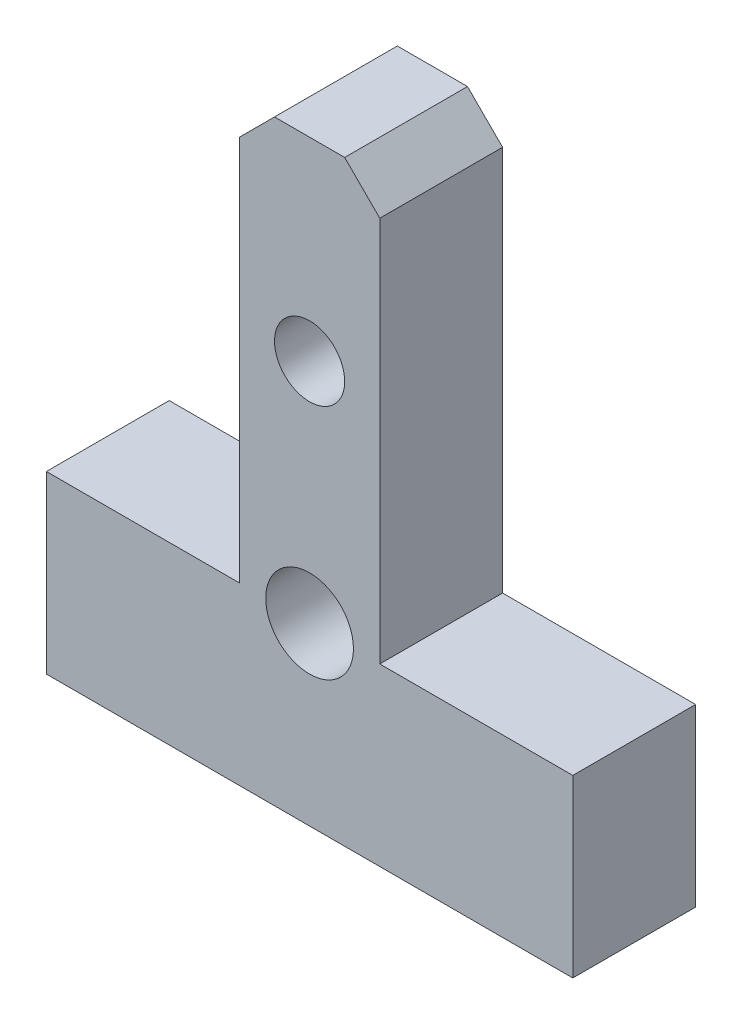
from build123d import *

# Parameters (mm, degrees)
EXTRUDE_1_DEPTH     = 7
SKETCH_3_W          = 8
SKETCH_3_H          = 7
EXTRUDE_3_DEPTH     = 13.5
SKETCH_2_R          = 2.5
SKETCH_2_R_2        = 1.999999991
CUT_EXTRUDE_2_DEPTH = 29.218856731
CHAMFER_1_SIZE      = 2


with BuildPart() as part:
    # Эскиз1 → Вытянуть1 (new body)
    with BuildSketch(Plane.XY):
        Polygon((-15, -1.146031522), (-15, -11.146031522), (15, -11.146031522), (15, -1.146031522), (4, -1.146031522), (4, 9.353968478), (-4, 9.353968478), (-4, -1.146031522), align=None)
    extrude(amount=EXTRUDE_1_DEPTH)

    # Эскиз3 → Вытянуть3 (add)
    with BuildSketch(Plane(origin=(0, 9.353968478, 0), x_dir=(1, 0, 0), z_dir=(0, 1, 0))):
        with Locations((0, -3.5)):
            Rectangle(SKETCH_3_W, SKETCH_3_H)
    extrude(amount=EXTRUDE_3_DEPTH)

    # Эскиз2 → Вытянуть2 (cut, through all)
    with BuildSketch(Plane.XY.offset(7)):
        with Locations((0, -1.14603177)):
            Circle(SKETCH_2_R)
        with Locations((4.2e-08, 11.794624395)):
            Circle(SKETCH_2_R_2)
    extrude(amount=-CUT_EXTRUDE_2_DEPTH, mode=Mode.SUBTRACT)

    # Фаска1
    chamfer_1_edges = [part.edges().sort_by_distance(p)[0] for p in [
        (-4, 22.853968478, 3.5),
        (4, 22.853968478, 3.5),
    ]]
    chamfer(chamfer_1_edges, length=CHAMFER_1_SIZE)


solid = part.part
